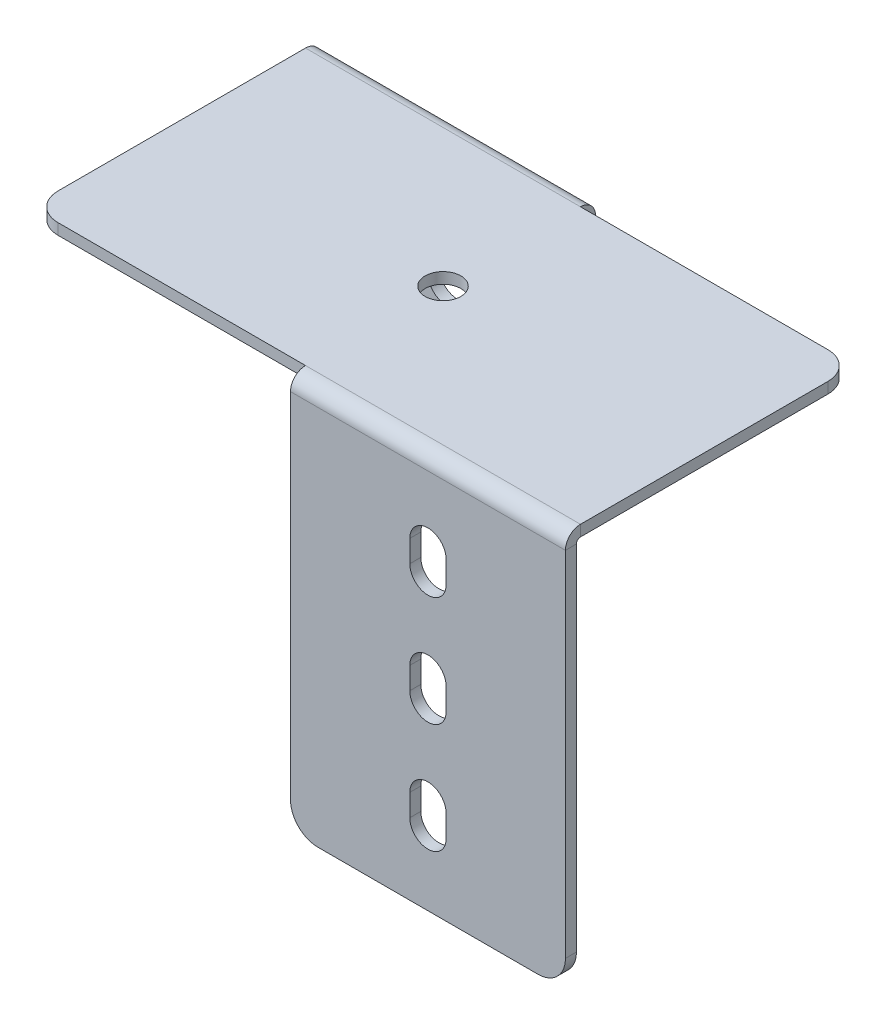
from build123d import *

# Parameters (mm, degrees)
SKETCH1_W          = 100
SKETCH1_H          = 50
BASE_FLANGE1_DEPTH = 2
SKETCH8_R          = 3.25
CUT_EXTRUDE1_DEPTH = 56.937465084
EDGE_FLANGE1_DEPTH = 50
EDGE_FLANGE2_DEPTH = 50
CUT_EXTRUDE2_DEPTH = 104.736569821
CUT_EXTRUDE3_DEPTH = 104.736569821
LPATTERN1_COUNT    = 3
LPATTERN1_PITCH    = 20
FILLET1_R          = 5


# Sheet-metal steps are written as plain solids
with BuildPart() as part:
    # Sketch1 → Base-Flange1 (new body)
    with BuildSketch(Plane(origin=(0, 0, 0), x_dir=(1, 0, 0), z_dir=(0, 1, 0))):
        Rectangle(SKETCH1_W, SKETCH1_H)
    extrude(amount=-BASE_FLANGE1_DEPTH)

    # Sketch8 → Cut-Extrude1 (cut, through all)
    with BuildSketch(Plane(origin=(0, 0, 0), x_dir=(1, 0, 0), z_dir=(0, 1, 0))):
        with Locations(Location((0, 0, 0), (0, 0, 270))):
            Circle(SKETCH8_R)
    extrude(amount=-CUT_EXTRUDE1_DEPTH, mode=Mode.SUBTRACT)

    # Edge-Flange1 section (across the edge) → Edge-Flange1 (add)
    with BuildSketch(Plane(origin=(50, -2, 25.7366), x_dir=(0, 0, -1), z_dir=(-1, 0, 0))):
        with BuildLine():
            Line((-2, 0.7366), (-2, 70))
            Line((-2, 70), (0, 70))
            Line((0, 70), (0, 0.7366))
            ThreePointArc((0, 0.7366), (0.215745145, 0.215745145), (0.7366, 0))
            Line((0.7366, 0), (0.7366, -2))
            ThreePointArc((0.7366, -2), (-1.198468417, -1.198468417), (-2, 0.7366))
        make_face()
    extrude(amount=EDGE_FLANGE1_DEPTH)

    # Edge-Flange2 section (across the edge) → Edge-Flange2 (add)
    with BuildSketch(Plane(origin=(-50, -2, -25.7366), x_dir=(0, 0, 1), z_dir=(1, 0, 0))):
        with BuildLine():
            Line((-2, 0.7366), (-2, 38))
            Line((-2, 38), (0, 38))
            Line((0, 38), (0, 0.7366))
            ThreePointArc((0, 0.7366), (0.215745145, 0.215745145), (0.7366, 0))
            Line((0.7366, 0), (0.7366, -2))
            ThreePointArc((0.7366, -2), (-1.198468417, -1.198468417), (-2, 0.7366))
        make_face()
    extrude(amount=EDGE_FLANGE2_DEPTH)

    # Sketch12 → Cut-Extrude2 (cut, through all)
    with BuildSketch(Plane.XY.offset(27.7366)):
        with BuildLine():
            Line((28.3, -55), (28.3, -59))
            ThreePointArc((28.3, -59), (25, -62.3), (21.7, -59))
            Line((21.7, -59), (21.7, -55))
            ThreePointArc((21.7, -55), (25, -51.7), (28.3, -55))
        make_face()
    cut_extrude2 = extrude(amount=-CUT_EXTRUDE2_DEPTH, mode=Mode.SUBTRACT)

    # Sketch16 → Cut-Extrude3 (cut, through all)
    with BuildSketch(Plane(origin=(0, 0, -27.7366), x_dir=(-1, 0, 0), z_dir=(0, 0, -1))):
        with BuildLine():
            Line((21.5, -25), (21.5, -15))
            ThreePointArc((21.5, -15), (25, -11.5), (28.5, -15))
            Line((28.5, -15), (28.5, -25))
            ThreePointArc((28.5, -25), (25, -28.5), (21.5, -25))
        make_face()
    extrude(amount=-CUT_EXTRUDE3_DEPTH, mode=Mode.SUBTRACT)

    # LPattern1: Cut-Extrude2 ×3
    with Locations(*[(0, i * LPATTERN1_PITCH, 0) for i in range(1, LPATTERN1_COUNT)]):
        add(cut_extrude2, mode=Mode.SUBTRACT)

    # Fillet1
    fillet1_edges = [part.edges().sort_by_distance(p)[0] for p in [
        (50, -72, 26.7366),
        (0, -72, 26.7366),
        (-50, -1, 25),
        (50, -1, -25),
        (-50, -40, -26.7366),
        (0, -40, -26.7366),
    ]]
    fillet(fillet1_edges, radius=FILLET1_R)


solid = part.part
